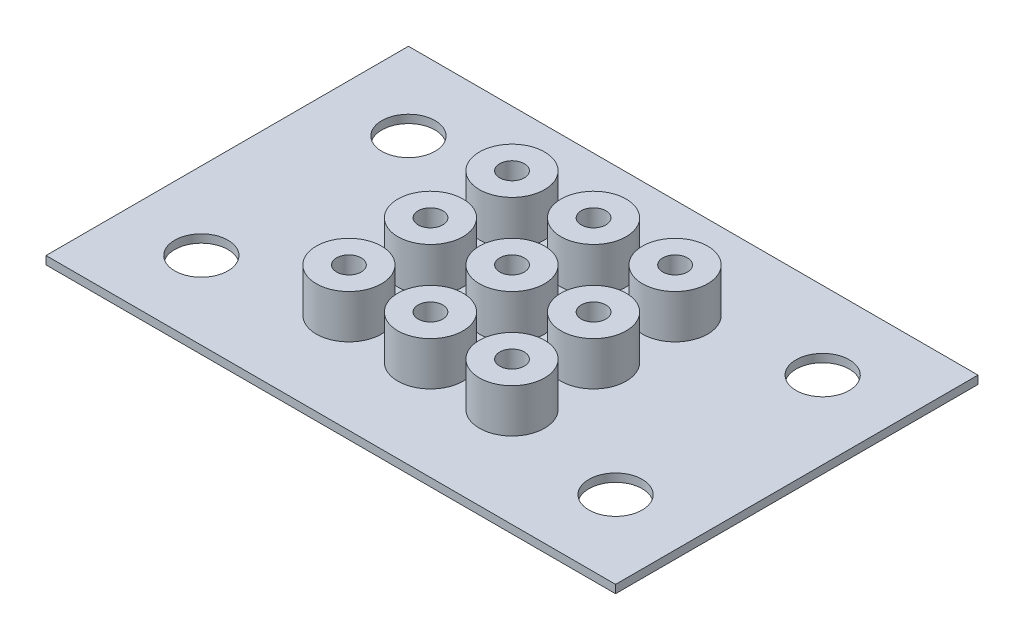
from build123d import *

# Parameters (mm, degrees)
SKETCH1_W           = 69.85
SKETCH1_H           = 44.45
SKETCH1_R           = 3.2639
SKETCH1_R_2         = 1.25
BOSS_EXTRUDE1_DEPTH = 1
SKETCH2_R           = 4
SKETCH2_R_2         = 1.51
BOSS_EXTRUDE2_DEPTH = 5.35


with BuildPart() as part:
    # Sketch1 → Boss-Extrude1 (new body)
    with BuildSketch(Plane(origin=(0, 0, 0), x_dir=(1, 0, 0), z_dir=(0, 1, 0))):
        with Locations((34.925, 22.225)):
            Rectangle(SKETCH1_W, SKETCH1_H)
        with Locations((9.525, 9.525)):
            Circle(SKETCH1_R, mode=Mode.SUBTRACT)
        with Locations((24.925, 12.225)):
            Circle(SKETCH1_R_2, mode=Mode.SUBTRACT)
        with Locations((24.925, 22.225)):
            Circle(SKETCH1_R_2, mode=Mode.SUBTRACT)
        with Locations((60.325, 9.525)):
            Circle(SKETCH1_R, mode=Mode.SUBTRACT)
        with Locations((34.925, 12.225)):
            Circle(SKETCH1_R_2, mode=Mode.SUBTRACT)
        with Locations((44.925, 12.225)):
            Circle(SKETCH1_R_2, mode=Mode.SUBTRACT)
        with Locations((24.925, 32.225)):
            Circle(SKETCH1_R_2, mode=Mode.SUBTRACT)
        with Locations((34.925, 32.225)):
            Circle(SKETCH1_R_2, mode=Mode.SUBTRACT)
        with Locations((9.525, 34.925)):
            Circle(SKETCH1_R, mode=Mode.SUBTRACT)
        with Locations((34.925, 22.225)):
            Circle(SKETCH1_R_2, mode=Mode.SUBTRACT)
        with Locations((44.925, 22.225)):
            Circle(SKETCH1_R_2, mode=Mode.SUBTRACT)
        with Locations((44.925, 32.225)):
            Circle(SKETCH1_R_2, mode=Mode.SUBTRACT)
        with Locations((60.325, 34.925)):
            Circle(SKETCH1_R, mode=Mode.SUBTRACT)
    extrude(amount=BOSS_EXTRUDE1_DEPTH)

    # Sketch2 → Boss-Extrude2 (add)
    # profile 1 of 9: a face of its own
    with BuildSketch(Plane(origin=(0, 1, 0), x_dir=(1, 0, 0), z_dir=(0, 1, 0))):
        with Locations((34.925, 22.225)):
            Circle(SKETCH2_R)
        with Locations((34.925, 22.225)):
            Circle(SKETCH2_R_2, mode=Mode.SUBTRACT)
    # profile 2 of 9: a face of its own
    with BuildSketch(Plane(origin=(0, 1, 0), x_dir=(1, 0, 0), z_dir=(0, 1, 0))):
        with Locations((44.925, 22.225)):
            Circle(SKETCH2_R)
        with Locations((44.925, 22.225)):
            Circle(SKETCH2_R_2, mode=Mode.SUBTRACT)
    # profile 3 of 9: a face of its own
    with BuildSketch(Plane(origin=(0, 1, 0), x_dir=(1, 0, 0), z_dir=(0, 1, 0))):
        with Locations((44.925, 32.225)):
            Circle(SKETCH2_R)
        with Locations((44.925, 32.225)):
            Circle(SKETCH2_R_2, mode=Mode.SUBTRACT)
    # profile 4 of 9: a face of its own
    with BuildSketch(Plane(origin=(0, 1, 0), x_dir=(1, 0, 0), z_dir=(0, 1, 0))):
        with Locations((34.925, 32.225)):
            Circle(SKETCH2_R)
        with Locations((34.925, 32.225)):
            Circle(SKETCH2_R_2, mode=Mode.SUBTRACT)
    # profile 5 of 9: a face of its own
    with BuildSketch(Plane(origin=(0, 1, 0), x_dir=(1, 0, 0), z_dir=(0, 1, 0))):
        with Locations((44.925, 12.225)):
            Circle(SKETCH2_R)
        with Locations((44.925, 12.225)):
            Circle(SKETCH2_R_2, mode=Mode.SUBTRACT)
    # profile 6 of 9: a face of its own
    with BuildSketch(Plane(origin=(0, 1, 0), x_dir=(1, 0, 0), z_dir=(0, 1, 0))):
        with Locations((34.925, 12.225)):
            Circle(SKETCH2_R)
        with Locations((34.925, 12.225)):
            Circle(SKETCH2_R_2, mode=Mode.SUBTRACT)
    # profile 7 of 9: a face of its own
    with BuildSketch(Plane(origin=(0, 1, 0), x_dir=(1, 0, 0), z_dir=(0, 1, 0))):
        with Locations((24.925, 22.225)):
            Circle(SKETCH2_R)
        with Locations((24.925, 22.225)):
            Circle(SKETCH2_R_2, mode=Mode.SUBTRACT)
    # profile 8 of 9: a face of its own
    with BuildSketch(Plane(origin=(0, 1, 0), x_dir=(1, 0, 0), z_dir=(0, 1, 0))):
        with Locations((24.925, 32.225)):
            Circle(SKETCH2_R)
        with Locations((24.925, 32.225)):
            Circle(SKETCH2_R_2, mode=Mode.SUBTRACT)
    # profile 9 of 9: a face of its own
    with BuildSketch(Plane(origin=(0, 1, 0), x_dir=(1, 0, 0), z_dir=(0, 1, 0))):
        with Locations((24.925, 12.225)):
            Circle(SKETCH2_R)
        with Locations((24.925, 12.225)):
            Circle(SKETCH2_R_2, mode=Mode.SUBTRACT)
    extrude(amount=BOSS_EXTRUDE2_DEPTH)


solid = part.part
